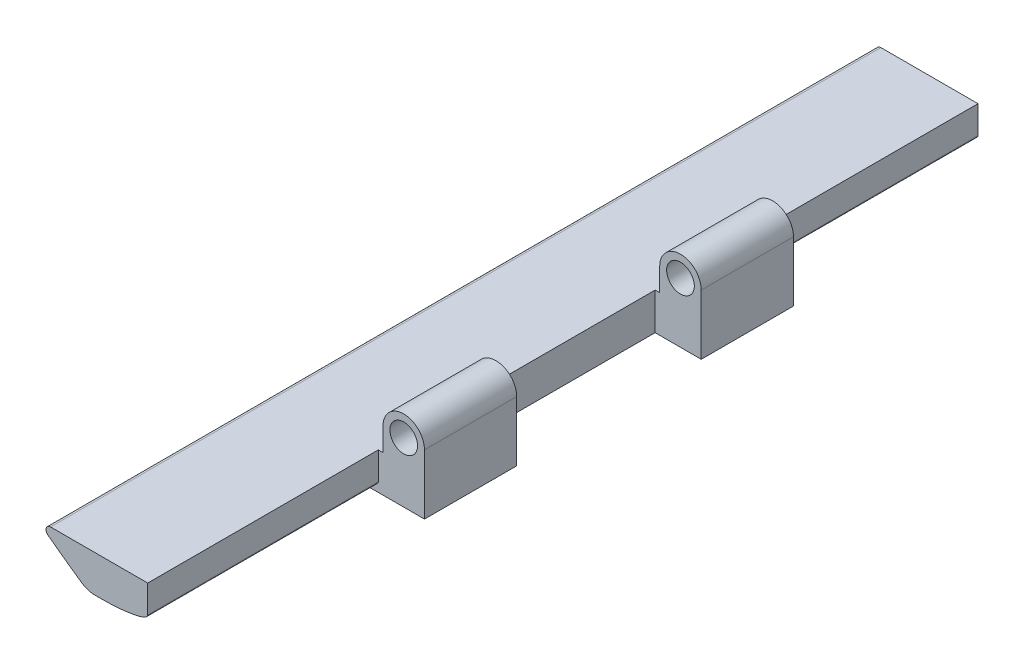
from build123d import *

# Parameters (mm, degrees)
SKETCH1_R           = 3
BOSS_EXTRUDE2_DEPTH = 180
SKETCH3_W           = 10
SKETCH3_H           = 50
CUT_EXTRUDE1_DEPTH  = 32
SKETCH4_W           = 10
SKETCH4_H           = 40
CUT_EXTRUDE2_DEPTH  = 32
FILLET3_R           = 1
FILLET4_R           = 5
FILLET5_SIZE        = 10
FILLET5_SIZE_2      = 2


with BuildPart() as part:
    # Sketch1 → Boss-Extrude2 (new body)
    # profile 1 of 2: a face of its own
    with BuildSketch(Plane.XY):
        with BuildLine():
            Line((75.196634753, -12.063439291), (75.196634753, 0.936560709))
            ThreePointArc((75.196634753, 0.936560709), (70.696634753, 5.436560709), (66.196634753, 0.936560709))
            Line((66.196634753, 0.936560709), (66.196634753, -4.063439291))
            Line((66.196634753, -4.063439291), (66.196634753, -12.063439291))
            Line((66.196634753, -12.063439291), (75.196634753, -12.063439291))
        make_face()
        with Locations(Location((70.696634753, 0.936560709, 0), (0, 0, 180))):
            Circle(SKETCH1_R, mode=Mode.SUBTRACT)
    # profile 2 of 2: a face of its own
    with BuildSketch(Plane.XY):
        with BuildLine():
            Line((41.196634753, -4.063439291), (66.196634753, -4.063439291))
            Line((66.196634753, -4.063439291), (66.196634753, -12.063439291))
            Line((66.196634753, -12.063439291), (52.196634753, -12.063439291))
            ThreePointArc((52.196634753, -12.063439291), (46.632466814, -8.151670207), (41.196634753, -4.063439291))
        make_face()
    extrude(amount=BOSS_EXTRUDE2_DEPTH)

    # Sketch3 → Cut-Extrude1 (cut)
    with BuildSketch(Plane.XZ.offset(12.063439291)):
        with Locations((70.196634753, 155)):
            Rectangle(SKETCH3_W, SKETCH3_H)
        with Locations((70.196634753, 25)):
            Rectangle(SKETCH3_W, SKETCH3_H)
    extrude(amount=-CUT_EXTRUDE1_DEPTH, mode=Mode.SUBTRACT)

    # Sketch4 → Cut-Extrude2 (cut)
    with BuildSketch(Plane(origin=(0, -12.063439291, 0), x_dir=(-1, 0, 0), z_dir=(0, -1, 0))):
        with Locations((-70.196634753, -90)):
            Rectangle(SKETCH4_W, SKETCH4_H)
    extrude(amount=-CUT_EXTRUDE2_DEPTH, mode=Mode.SUBTRACT)

    # Fillet3
    fillet3_edges = [part.edges().sort_by_distance(p)[0] for p in [
        (41.196634753, -4.063439291, 90),
    ]]
    fillet(fillet3_edges, radius=FILLET3_R)

    # Fillet4
    fillet4_edges = [part.edges().sort_by_distance(p)[0] for p in [
        (52.196634753, -12.063439291, 90),
    ]]
    fillet(fillet4_edges, radius=FILLET4_R)

    # Fillet5
    # an asymmetric fillet: 10, 2 mm, written as the material it takes off along each edge
    with BuildSketch(Plane(origin=(65.196634753, -12.063439291, 205), x_dir=(-1, 0, 0), z_dir=(0, 0, -1))) as fillet5_piece_1:
        with BuildLine():
            Bezier((FILLET5_SIZE, 0), (0, 0), (0, FILLET5_SIZE_2), weights=[1, 0.707106781, 1])
            Line((0, FILLET5_SIZE_2), (0, 0))
            Line((0, 0), (FILLET5_SIZE, 0))
        make_face()
    extrude(amount=75, mode=Mode.SUBTRACT)
    with BuildSketch(Plane(origin=(65.196634753, -12.063439291, -25), x_dir=(-1, 0, 0), z_dir=(0, 0, 1))) as fillet5_piece_2:
        with BuildLine():
            Bezier((FILLET5_SIZE, 0), (0, 0), (0, -FILLET5_SIZE_2), weights=[1, 0.707106781, 1])
            Line((0, -FILLET5_SIZE_2), (0, 0))
            Line((0, 0), (FILLET5_SIZE, 0))
        make_face()
    extrude(amount=75, mode=Mode.SUBTRACT)


solid = part.part
